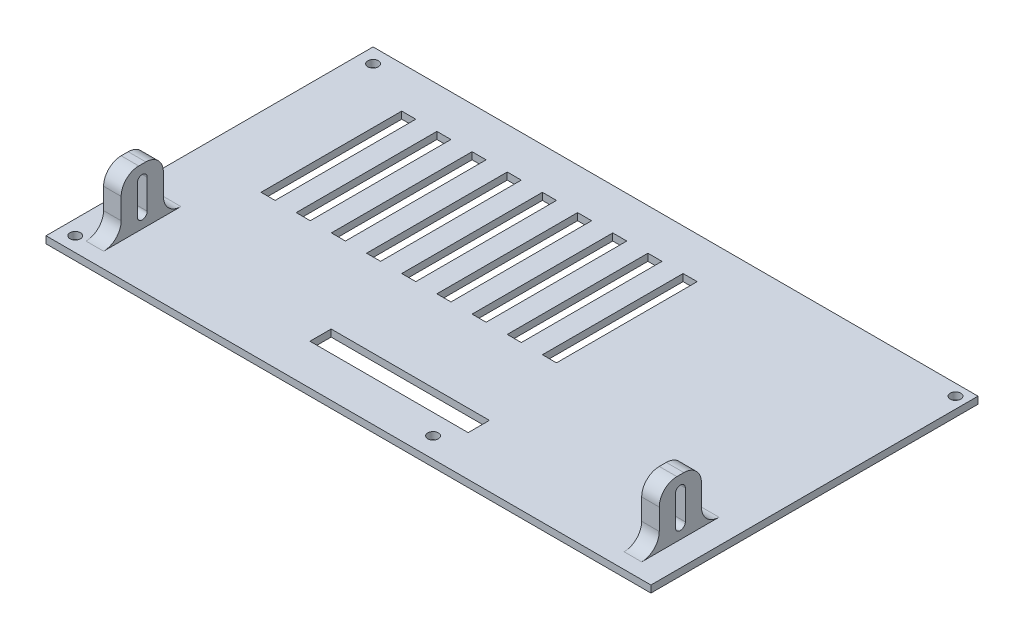
from build123d import *

# Parameters (mm, degrees)
SKETCH1_W            = 172
SKETCH1_H            = 93
BOSS_EXTRUDE1_DEPTH  = 1
SKETCH2_W            = 172
SKETCH2_H            = 93
SKETCH2_W_2          = 169
SKETCH2_H_2          = 90
BOSS_EXTRUDE2_DEPTH  = 21.5
SKETCH3_W            = 14.5
SKETCH3_H            = 20
SKETCH3_W_2          = 16.2
SKETCH3_W_3          = 76
SKETCH3_H_2          = 7
CUT_EXTRUDE1_DEPTH   = 21.5
BOSS_EXTRUDE3_DEPTH  = 10
FILLET1_R            = 4
SKETCH5_R            = 1.5
BOSS_EXTRUDE4_DEPTH  = 2.5
BOSS_EXTRUDE5_DEPTH  = 10
SKETCH7_W            = 1.5
SKETCH7_H            = 3.5
BOSS_EXTRUDE6_DEPTH  = 10
FILLET2_R            = 4
SKETCH8_R            = 4
SKETCH8_R_2          = 1.5
BOSS_EXTRUDE7_DEPTH  = 14
SKETCH10_W           = 16
SKETCH10_H           = 4
CUT_EXTRUDE2_DEPTH   = 14
CUT_EXTRUDE3_DEPTH   = 1.6
FILLET3_R            = 4
SKETCH12_W           = 10
SKETCH12_H           = 6
SKETCH12_W_2         = 8
SKETCH12_H_2         = 8
CUT_EXTRUDE4_DEPTH   = 25.1
SKETCH13_W           = 6.4
SKETCH13_H           = 6.4
SKETCH13_W_2         = 6
SKETCH13_H_2         = 6
BOSS_EXTRUDE8_DEPTH  = 21.5
FILLET4_R            = 3
SKETCH14_R           = 1.5
CUT_EXTRUDE5_DEPTH   = 20
SKETCH15_W           = 172
SKETCH15_H           = 93
SKETCH15_R           = 1.5
SKETCH15_W_2         = 4
SKETCH15_H_2         = 40
SKETCH15_W_3         = 45
SKETCH15_H_3         = 6.0381788
BOSS_EXTRUDE9_DEPTH  = 2
SKETCH16_W           = 56
SKETCH16_H           = 7.274551358
CUT_EXTRUDE6_DEPTH   = 2
SKETCH17_W           = 5
SKETCH17_H           = 12
BOSS_EXTRUDE10_DEPTH = 16
FILLET6_R            = 5
CUT_EXTRUDE7_DEPTH   = 166


# Read off the part's stored shape, not the designer's step: Intersect2
# Some blends are built 0.0001 mm under size
with BuildPart() as part:
    # Sketch1 → Boss-Extrude1 (new body)
    with BuildSketch(Plane(origin=(0, 0, 0), x_dir=(1, 0, 0), z_dir=(0, 1, 0))):
        Rectangle(SKETCH1_W, SKETCH1_H)
    extrude(amount=BOSS_EXTRUDE1_DEPTH)

    # Sketch2 → Boss-Extrude2 (add)
    with BuildSketch(Plane(origin=(0, 1, 0), x_dir=(1, 0, 0), z_dir=(0, 1, 0))):
        Rectangle(SKETCH2_W, SKETCH2_H)
        Rectangle(SKETCH2_W_2, SKETCH2_H_2, mode=Mode.SUBTRACT)
    extrude(amount=BOSS_EXTRUDE2_DEPTH)

    # Sketch3 → Cut-Extrude1 (cut)
    with BuildSketch(Plane.XY.offset(46.5)):
        with Locations((74.75, 11)):
            Rectangle(SKETCH3_W, SKETCH3_H)
        with Locations((57.75, 11)):
            Rectangle(SKETCH3_W, SKETCH3_H)
        with Locations((39, 11)):
            Rectangle(SKETCH3_W_2, SKETCH3_H)
        with Locations((-30.2, 6.2)):
            Rectangle(SKETCH3_W_3, SKETCH3_H_2)
    extrude(amount=-CUT_EXTRUDE1_DEPTH, mode=Mode.SUBTRACT)

    # Sketch4 → Boss-Extrude3 (add)
    with BuildSketch(Plane(origin=(0, 1, 0), x_dir=(1, 0, 0), z_dir=(0, 1, 0))):
        Polygon((26.9, -45), (28.4, -45), (28.4, 40.1), (84.5, 40.1), (84.5, 41.6), (26.9, 41.6), align=None)
    extrude(amount=BOSS_EXTRUDE3_DEPTH)

    # Fillet1
    fillet1_edges = [part.edges().sort_by_distance(p)[0] for p in [
        (26.9, 6, 45),
    ]]
    fillet(fillet1_edges, radius=FILLET1_R)

    # Sketch5 → Boss-Extrude4 (add)
    # profile 1 of 4: a face of its own
    with BuildSketch(Plane(origin=(0, 1, 0), x_dir=(1, 0, 0), z_dir=(0, 1, 0))):
        with BuildLine():
            Line((28.4, 40.1), (35.4, 40.1))
            Line((35.4, 40.1), (35.4, 35.1))
            ThreePointArc((35.4, 35.1), (34.814213562, 33.685786438), (33.4, 33.1))
            Line((33.4, 33.1), (28.4, 33.1))
            Line((28.4, 33.1), (28.4, 40.1))
        make_face()
        with Locations(Location((32.6, 36.1, 0), (0, 0, 270))):
            Circle(SKETCH5_R, mode=Mode.SUBTRACT)
    # profile 2 of 4: a face of its own
    with BuildSketch(Plane(origin=(0, 1, 0), x_dir=(1, 0, 0), z_dir=(0, 1, 0))):
        with BuildLine():
            Line((84.5, 40.1), (77.5, 40.1))
            Line((77.5, 40.1), (77.5, 35.1))
            ThreePointArc((77.5, 35.1), (78.085786438, 33.685786438), (79.5, 33.1))
            Line((79.5, 33.1), (84.5, 33.1))
            Line((84.5, 33.1), (84.5, 40.1))
        make_face()
        with Locations(Location((80.3, 36.1, 0), (0, 0, 270))):
            Circle(SKETCH5_R, mode=Mode.SUBTRACT)
    # profile 3 of 4: a face of its own
    with BuildSketch(Plane(origin=(0, 1, 0), x_dir=(1, 0, 0), z_dir=(0, 1, 0))):
        with BuildLine():
            Line((28.4, -18.4), (33.533804299, -18.4))
            ThreePointArc((33.533804299, -18.4), (34.948017861, -18.985786438), (35.533804299, -20.4))
            Line((35.533804299, -20.4), (35.533804299, -23.4))
            ThreePointArc((35.533804299, -23.4), (34.948017861, -24.814213562), (33.533804299, -25.4))
            Line((33.533804299, -25.4), (28.4, -25.4))
            Line((28.4, -25.4), (28.4, -18.4))
        make_face()
        with Locations(Location((32.6, -21.9, 0), (0, 0, 270))):
            Circle(SKETCH5_R, mode=Mode.SUBTRACT)
    # profile 4 of 4: a face of its own
    with BuildSketch(Plane(origin=(0, 1, 0), x_dir=(1, 0, 0), z_dir=(0, 1, 0))):
        with BuildLine():
            Line((84.5, -18.4), (79.00543069, -18.4))
            ThreePointArc((79.00543069, -18.4), (77.591217128, -18.985786438), (77.00543069, -20.4))
            Line((77.00543069, -20.4), (77.00543069, -23.4))
            ThreePointArc((77.00543069, -23.4), (77.591217128, -24.814213562), (79.00543069, -25.4))
            Line((79.00543069, -25.4), (84.5, -25.4))
            Line((84.5, -25.4), (84.5, -18.4))
        make_face()
        with Locations(Location((80.3, -21.9, 0), (0, 0, 270))):
            Circle(SKETCH5_R, mode=Mode.SUBTRACT)
    extrude(amount=BOSS_EXTRUDE4_DEPTH)

    # Sketch6 → Boss-Extrude5 (add)
    with BuildSketch(Plane(origin=(0, 1, 0), x_dir=(1, 0, 0), z_dir=(0, 1, 0))):
        Polygon((-65.7, -40), (-68.2, -40), (-68.2, -37.9), (-65.7, -37.9), (-65.7, -36.402716815), (-69.7, -36.402716815), (-69.7, -41.5), (-65.7, -41.5), align=None)
        Polygon((5.3, -36.402716815), (5.3, -37.9), (7.8, -37.9), (7.8, -40), (5.3, -40), (5.3, -41.5), (9.3, -41.5), (9.3, -36.402716815), align=None)
    extrude(amount=BOSS_EXTRUDE5_DEPTH)

    # Sketch7 → Boss-Extrude6 (add)
    with BuildSketch(Plane(origin=(0, 1, 0), x_dir=(1, 0, 0), z_dir=(0, 1, 0))):
        with Locations((-68.95, -43.25)):
            Rectangle(SKETCH7_W, SKETCH7_H)
        with Locations((8.55, -43.25)):
            Rectangle(SKETCH7_W, SKETCH7_H)
    extrude(amount=BOSS_EXTRUDE6_DEPTH)

    # Fillet2
    fillet2_edges = [part.edges().sort_by_distance(p)[0] for p in [
        (-69.7, 6, 45),
        (9.3, 6, 45),
    ]]
    fillet(fillet2_edges, radius=FILLET2_R)

    # Sketch8 → Boss-Extrude7 (add)
    # profile 1 of 3: a face of its own
    with BuildSketch(Plane(origin=(0, 1, 0), x_dir=(1, 0, 0), z_dir=(0, 1, 0))):
        with Locations(Location((-38.2, -6, 0), (0, 0, 90))):
            Circle(SKETCH8_R)
        with Locations(Location((-38.2, -6, 0), (0, 0, 270))):
            Circle(SKETCH8_R_2, mode=Mode.SUBTRACT)
    # profile 2 of 3: a face of its own
    with BuildSketch(Plane(origin=(0, 1, 0), x_dir=(1, 0, 0), z_dir=(0, 1, 0))):
        with Locations(Location((-36.5, 40, 0), (0, 0, 90))):
            Circle(SKETCH8_R)
        with Locations(Location((-36.5, 40, 0), (0, 0, 270))):
            Circle(SKETCH8_R_2, mode=Mode.SUBTRACT)
    # profile 3 of 3: a face of its own
    with BuildSketch(Plane(origin=(0, 1, 0), x_dir=(1, 0, 0), z_dir=(0, 1, 0))):
        with Locations(Location((13.5, 17, 0), (0, 0, 90))):
            Circle(SKETCH8_R)
    extrude(amount=BOSS_EXTRUDE7_DEPTH)

    # Sketch10 → Cut-Extrude2 (cut)
    with BuildSketch(Plane(origin=(0, 0, -46.5), x_dir=(-1, 0, 0), z_dir=(0, 0, -1))):
        with Locations((-55.7, 3)):
            Rectangle(SKETCH10_W, SKETCH10_H)
    extrude(amount=-CUT_EXTRUDE2_DEPTH, mode=Mode.SUBTRACT)

    # Sketch11 → Cut-Extrude3 (cut)
    with BuildSketch(Plane(origin=(0, 0, -46.5), x_dir=(-1, 0, 0), z_dir=(0, 0, -1))):
        with BuildLine():
            Line((-65.7, 12), (-45.7, 12))
            ThreePointArc((-45.7, 12), (-44.285786438, 11.414213562), (-43.7, 10))
            Line((-43.7, 10), (-43.7, 3))
            ThreePointArc((-43.7, 3), (-44.285786438, 1.585786438), (-45.7, 1))
            Line((-45.7, 1), (-65.7, 1))
            ThreePointArc((-65.7, 1), (-67.114213562, 1.585786438), (-67.7, 3))
            Line((-67.7, 3), (-67.7, 10))
            ThreePointArc((-67.7, 10), (-67.114213562, 11.414213562), (-65.7, 12))
        make_face()
    extrude(amount=-CUT_EXTRUDE3_DEPTH, mode=Mode.SUBTRACT)

    # Fillet3
    # the kernel refuses this fillet: 4 mm, written as the material it adds along each edge
    with BuildSketch(Plane(origin=(-36.5, 1, -40), x_dir=(0, 0, -1), z_dir=(1, 0, 0))) as fillet3_piece_1_section:
        with BuildLine():
            CenterArc((4 + FILLET3_R, FILLET3_R), FILLET3_R, 180, 90)
            Line((4, FILLET3_R), (4, 0))
            Line((4, 0), (4 + FILLET3_R, 0))
        make_face()
    fillet3_piece_1 = revolve(axis=Axis((-36.5, 1, -40), (0, 1, 0)), mode=Mode.PRIVATE)
    fillet3_piece_1 = split(fillet3_piece_1, bisect_by=Plane(origin=(-36.5, 1, -45), z_dir=(0, 0, 1)), keep=Keep.TOP, mode=Mode.PRIVATE)
    add(fillet3_piece_1)
    with BuildSketch(Plane(origin=(-38.2, 1, 6), x_dir=(0, 0, -1), z_dir=(1, 0, 0))) as fillet3_piece_2:
        with BuildLine():
            CenterArc((4 + FILLET3_R, FILLET3_R), FILLET3_R, 180, 90)
            Line((4, FILLET3_R), (4, 0))
            Line((4, 0), (4 + FILLET3_R, 0))
        make_face()
    revolve(axis=Axis((-38.2, 1, 6), (0, 1, 0)))
    with BuildSketch(Plane(origin=(13.5, 1, -17), x_dir=(0, 0, -1), z_dir=(1, 0, 0))) as fillet3_piece_3:
        with BuildLine():
            CenterArc((4 + FILLET3_R, FILLET3_R), FILLET3_R, 180, 90)
            Line((4, FILLET3_R), (4, 0))
            Line((4, 0), (4 + FILLET3_R, 0))
        make_face()
    revolve(axis=Axis((13.5, 1, -17), (0, 1, 0)))

    # Sketch12 → Cut-Extrude4 (cut)
    with BuildSketch(Plane(origin=(0, 0, -46.5), x_dir=(-1, 0, 0), z_dir=(0, 0, -1))):
        with Locations((27.5, 12)):
            Rectangle(SKETCH12_W, SKETCH12_H)
        Polygon((-13.5, 15), (-13.5, 16), (6.5, 16), (6.5, 15), (6.5, 6), (-13.5, 6), align=None)
        with Locations((-29, 11)):
            Rectangle(SKETCH12_W_2, SKETCH12_H_2)
    extrude(amount=-CUT_EXTRUDE4_DEPTH, mode=Mode.SUBTRACT)

    # Sketch13 → Boss-Extrude8 (add)
    with BuildSketch(Plane(origin=(0, 1, 0), x_dir=(1, 0, 0), z_dir=(0, 1, 0))):
        with Locations((82.8, 43.3)):
            Rectangle(SKETCH13_W, SKETCH13_H)
        with Locations((-81.5, 42)):
            Rectangle(SKETCH13_W_2, SKETCH13_H_2)
        with Locations((-81.5, -42)):
            Rectangle(SKETCH13_W_2, SKETCH13_H_2)
        with BuildLine():
            Line((13.3, -45), (23.3, -45))
            Line((23.3, -45), (23.3, -39))
            ThreePointArc((23.3, -39), (22.128427125, -36.171572875), (19.3, -35))
            Line((19.3, -35), (17.3, -35))
            ThreePointArc((17.3, -35), (14.471572875, -36.171572875), (13.3, -39))
            Line((13.3, -39), (13.3, -45))
        make_face()
    extrude(amount=BOSS_EXTRUDE8_DEPTH)

    # Fillet4
    fillet4_edges = [part.edges().sort_by_distance(p)[0] for p in [
        (-78.5, 11.75, 39),
        (-78.5, 11.75, 45),
        (-84.5, 11.75, 39),
        (-78.5, 11.75, -39),
        (-78.5, 11.75, -45),
        (-84.5, 11.75, -39),
    ]]
    fillet(fillet4_edges, radius=FILLET4_R - 0.0001)  # a hair under: the kernel refuses the full size

    # Sketch14 → Cut-Extrude5 (cut)
    with BuildSketch(Plane(origin=(0, 22.5, 0), x_dir=(1, 0, 0), z_dir=(0, 1, 0))):
        with Locations(Location((-81.844819979, 42.344819979, 0), (0, 0, 270))):
            Circle(SKETCH14_R)
        with Locations(Location((-81.844819979, -42.344819979, 0), (0, 0, 270))):
            Circle(SKETCH14_R)
        with Locations(Location((18.3, -40.75, 0), (0, 0, 270))):
            Circle(SKETCH14_R)
        with Locations(Location((82.8, 43.3, 0), (0, 0, 270))):
            Circle(SKETCH14_R)
    extrude(amount=-CUT_EXTRUDE5_DEPTH, mode=Mode.SUBTRACT)

    # Sketch16 → Cut-Extrude6 (cut)
    with BuildSketch(Plane(origin=(86, 0, 0), x_dir=(0, 0, -1), z_dir=(1, 0, 0))):
        with Locations((8, 18.862724321)):
            Rectangle(SKETCH16_W, SKETCH16_H)
    extrude(amount=-CUT_EXTRUDE6_DEPTH, mode=Mode.SUBTRACT)


with BuildPart() as body_2:
    # Sketch15 → Boss-Extrude9 (new body)
    with BuildSketch(Plane(origin=(0, 22.5, 0), x_dir=(1, 0, 0), z_dir=(0, 1, 0))):
        Rectangle(SKETCH15_W, SKETCH15_H)
        with Locations(Location((82.8, 43.3, 0), (0, 0, 270))):
            Circle(SKETCH15_R, mode=Mode.SUBTRACT)
        with Locations(Location((18.3, -40.75, 0), (0, 0, 270))):
            Circle(SKETCH15_R, mode=Mode.SUBTRACT)
        with Locations(Location((-81.844819979, -42.344819979, 0), (0, 0, 270))):
            Circle(SKETCH15_R, mode=Mode.SUBTRACT)
        with Locations(Location((-81.844819979, 42.344819979, 0), (0, 0, 270))):
            Circle(SKETCH15_R, mode=Mode.SUBTRACT)
        with Locations((-54.124331846, 14.769848195)):
            Rectangle(SKETCH15_W_2, SKETCH15_H_2, mode=Mode.SUBTRACT)
        with Locations((-64.124331846, 14.769848195)):
            Rectangle(SKETCH15_W_2, SKETCH15_H_2, mode=Mode.SUBTRACT)
        with Locations((-44.124331846, 14.769848195)):
            Rectangle(SKETCH15_W_2, SKETCH15_H_2, mode=Mode.SUBTRACT)
        with Locations((-34.124331846, 14.769848195)):
            Rectangle(SKETCH15_W_2, SKETCH15_H_2, mode=Mode.SUBTRACT)
        with Locations((-24.124331846, 14.769848195)):
            Rectangle(SKETCH15_W_2, SKETCH15_H_2, mode=Mode.SUBTRACT)
        with Locations((-14.124331846, 14.769848195)):
            Rectangle(SKETCH15_W_2, SKETCH15_H_2, mode=Mode.SUBTRACT)
        with Locations((-4.124331846, 14.769848195)):
            Rectangle(SKETCH15_W_2, SKETCH15_H_2, mode=Mode.SUBTRACT)
        with Locations((5.875668154, 14.769848195)):
            Rectangle(SKETCH15_W_2, SKETCH15_H_2, mode=Mode.SUBTRACT)
        with Locations((15.875668154, 14.769848195)):
            Rectangle(SKETCH15_W_2, SKETCH15_H_2, mode=Mode.SUBTRACT)
        with Locations((0, -31.942161626)):
            Rectangle(SKETCH15_W_3, SKETCH15_H_3, mode=Mode.SUBTRACT)
    extrude(amount=BOSS_EXTRUDE9_DEPTH)

    # Sketch17 → Boss-Extrude10 (add)
    with BuildSketch(Plane(origin=(0, 24.5, 0), x_dir=(1, 0, 0), z_dir=(0, 1, 0))):
        with Locations((-76.5, -31.128066602)):
            Rectangle(SKETCH17_W, SKETCH17_H)
        with Locations((76.5, -31.128066602)):
            Rectangle(SKETCH17_W, SKETCH17_H)
    extrude(amount=BOSS_EXTRUDE10_DEPTH)

    # Fillet6
    fillet6_edges = [body_2.edges().sort_by_distance(p)[0] for p in [
        (-76.5, 24.5, 37.128066602),
        (-76.5, 24.5, 25.128066602),
        (-76.5, 40.5, 37.128066602),
        (-76.5, 40.5, 25.128066602),
        (76.5, 24.5, 25.128066602),
        (76.5, 24.5, 37.128066602),
        (76.5, 40.5, 25.128066602),
        (76.5, 40.5, 37.128066602),
    ]]
    fillet(fillet6_edges, radius=FILLET6_R)

    # Sketch18 → Cut-Extrude7 (cut)
    with BuildSketch(Plane(origin=(79, 0, 0), x_dir=(0, 0, -1), z_dir=(1, 0, 0))):
        with BuildLine():
            Line((-32.54071408, 28.146472212), (-32.54071408, 36.484701473))
            ThreePointArc((-32.54071408, 36.484701473), (-31.128066602, 37.89734895), (-29.715419125, 36.484701473))
            Line((-29.715419125, 36.484701473), (-29.715419125, 28.146472212))
            ThreePointArc((-29.715419125, 28.146472212), (-31.128066602, 26.733824735), (-32.54071408, 28.146472212))
        make_face()
    extrude(amount=-CUT_EXTRUDE7_DEPTH, mode=Mode.SUBTRACT)


solid = body_2.part
